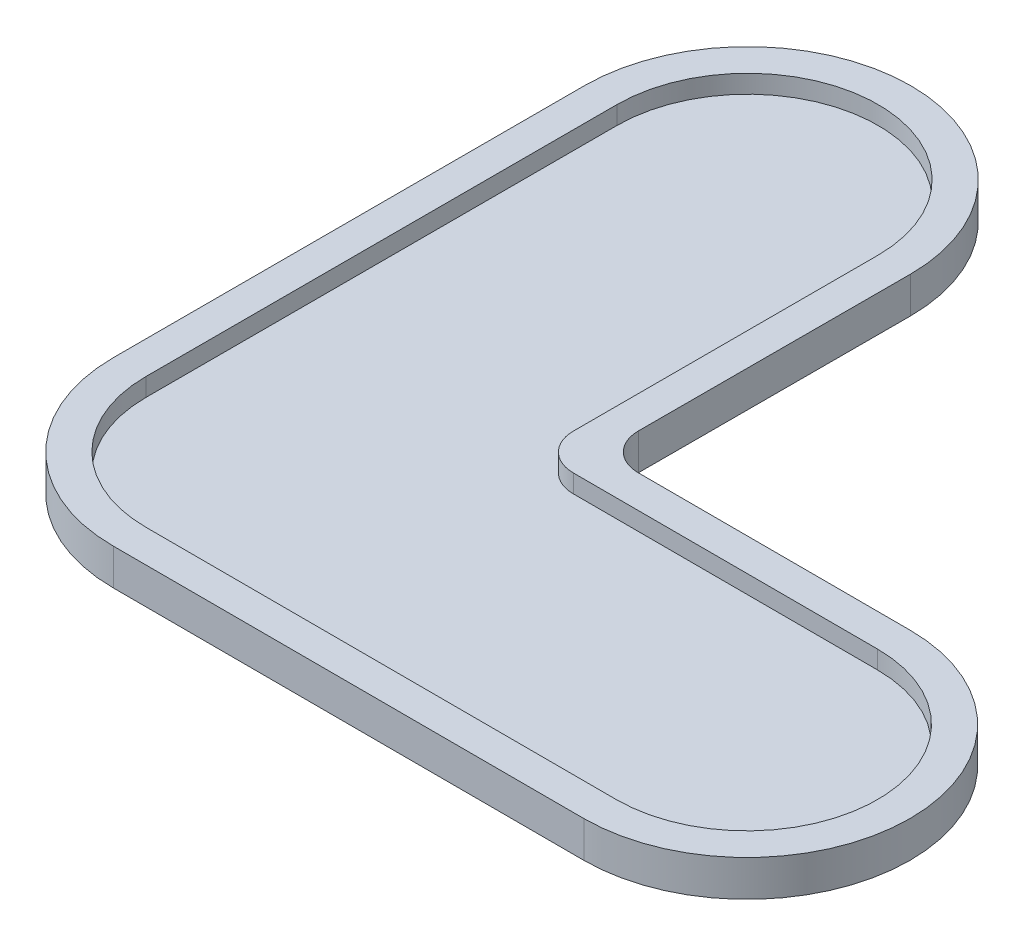
from build123d import *

# Parameters (mm, degrees)
BOSS_EXTRUDE1_DEPTH = 10
CUT_EXTRUDE1_START  = -5
CUT_EXTRUDE1_DEPTH  = 5
FILLET1_R           = 10
FILLET2_R           = 10


# Read off the part's stored shape, not the designer's step: Cut-Extrude1
with BuildPart() as part:
    # Sketch1 → Boss-Extrude1 (new body)
    with BuildSketch(Plane(origin=(0, 0, 0), x_dir=(1, 0, 0), z_dir=(0, 1, 0))):
        with BuildLine():
            ThreePointArc((130, -45.182255659), (175, -0.182255659), (130, 44.817744341))
            Line((130, 44.817744341), (44.916086644, 44.937029146))
            Line((44.916086644, 44.937029146), (45, 130))
            ThreePointArc((45, 130), (0, 175), (-45, 130))
            Line((-45, 130), (-45, 0))
            ThreePointArc((-45, 0), (-31.819805153, -31.819805153), (0, -45))
            Line((0, -45), (130, -45.182255659))
        make_face()
    extrude(amount=BOSS_EXTRUDE1_DEPTH)

    # Cut-Extrude1 outline → Cut-Extrude1 (cut)
    with BuildSketch(Plane(origin=(0, 10, 0), x_dir=(1, 0, 0), z_dir=(0, 1, 0)).offset(CUT_EXTRUDE1_START)):
        with BuildLine():
            Line((36, 35.949529202), (36, 130))
            ThreePointArc((36, 130), (0, 166), (-36, 130))
            Line((-36, 130), (-36, 0))
            ThreePointArc((-36, 0), (-25.455844123, -25.455844123), (0, -36))
            Line((0, -36), (130, -36.182255659))
            ThreePointArc((130, -36.182255659), (166, -0.182255659), (130, 35.817744341))
            Line((130, 35.817744341), (36, 35.949529202))
        make_face()
    extrude(amount=CUT_EXTRUDE1_DEPTH, mode=Mode.SUBTRACT)

    # Fillet1
    fillet1_edges = [part.edges().sort_by_distance(p)[0] for p in [
        (44.916086644, 5, -44.937029146),
    ]]
    fillet(fillet1_edges, radius=FILLET1_R)

    # Fillet2
    fillet2_edges = [part.edges().sort_by_distance(p)[0] for p in [
        (36, 7.5, -35.949529202),
    ]]
    fillet(fillet2_edges, radius=FILLET2_R)


solid = part.part
